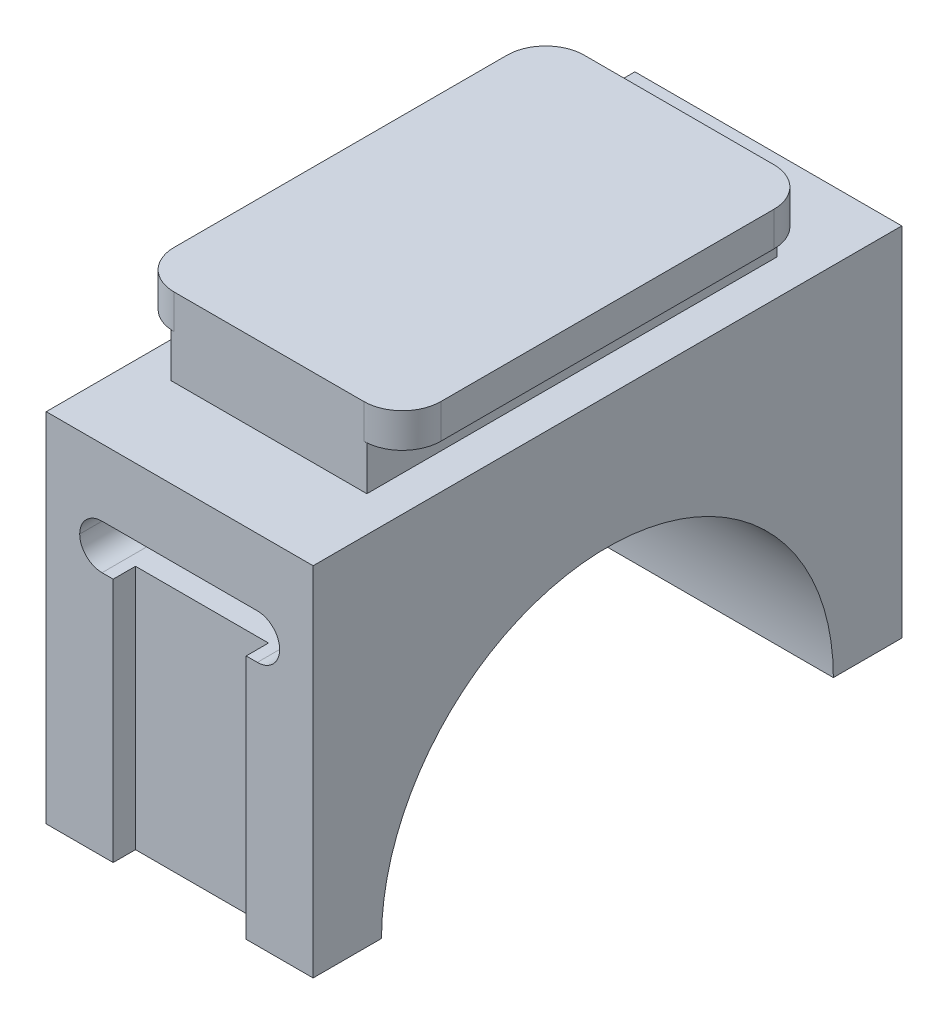
from build123d import *

# Parameters (mm, degrees)
BOSS_EXTRUDE1_DEPTH = 1.9558
SKETCH2_W           = 11.1506
SKETCH2_H           = 23.3426
BOSS_EXTRUDE2_DEPTH = 2.5019
SKETCH3_W           = 15.1892
SKETCH3_H           = 33.5026
BOSS_EXTRUDE3_DEPTH = 20.32
SKETCH4_R           = 12.85875
CUT_EXTRUDE1_DEPTH  = 40.489177087
SKETCH5_W           = 11.3792
SKETCH5_H           = 2.54
CUT_EXTRUDE2_DEPTH  = 44.289434312
FILLET1_R           = 1.27
SKETCH6_W           = 7.5692
SKETCH6_H           = 13.97
CUT_EXTRUDE3_DEPTH  = 1.27
SKETCH7_W           = 7.5692
SKETCH7_H           = 13.97
CUT_EXTRUDE4_DEPTH  = 1.27


with BuildPart() as part:
    # Sketch1 → Boss-Extrude1 (new body)
    with BuildSketch(Plane(origin=(0, 0, 0), x_dir=(1, 0, 0), z_dir=(0, 1, 0))):
        with BuildLine():
            Line((2.1971, 0), (12.9921, 0))
            ThreePointArc((12.9921, 0), (14.545684309, -0.643515691), (15.1892, -2.1971))
            Line((15.1892, -2.1971), (15.1892, -21.1455))
            ThreePointArc((15.1892, -21.1455), (14.545684309, -22.699084309), (12.9921, -23.3426))
            Line((12.9921, -23.3426), (2.1971, -23.3426))
            ThreePointArc((2.1971, -23.3426), (0.643515691, -22.699084309), (0, -21.1455))
            Line((0, -21.1455), (0, -2.1971))
            ThreePointArc((0, -2.1971), (0.643515691, -0.643515691), (2.1971, 0))
        make_face()
    extrude(amount=BOSS_EXTRUDE1_DEPTH)

    # Sketch2 → Boss-Extrude2 (add)
    with BuildSketch(Plane.XZ):
        with Locations((7.5946, 11.6713)):
            Rectangle(SKETCH2_W, SKETCH2_H)
    extrude(amount=BOSS_EXTRUDE2_DEPTH)

    # Sketch3 → Boss-Extrude3 (add)
    with BuildSketch(Plane.XZ.offset(2.5019)):
        with Locations((7.5946, 11.6713)):
            Rectangle(SKETCH3_W, SKETCH3_H)
    extrude(amount=BOSS_EXTRUDE3_DEPTH)

    # Sketch4 → Cut-Extrude1 (cut, through all)
    with BuildSketch(Plane(origin=(15.1892, 0, 0), x_dir=(0, 0, -1), z_dir=(1, 0, 0))):
        with Locations((-11.6713, -22.8219)):
            Circle(SKETCH4_R)
    extrude(amount=-CUT_EXTRUDE1_DEPTH, mode=Mode.SUBTRACT)

    # Sketch5 → Cut-Extrude2 (cut, through all)
    with BuildSketch(Plane.XY.offset(28.4226)):
        with Locations((7.5946, -7.5819)):
            Rectangle(SKETCH5_W, SKETCH5_H)
    extrude(amount=-CUT_EXTRUDE2_DEPTH, mode=Mode.SUBTRACT)

    # Fillet1
    fillet1_edges = [part.edges().sort_by_distance(p)[0] for p in [
        (13.2842, -8.8519, 11.6713),
        (13.2842, -6.3119, 11.6713),
        (1.905, -6.3119, 11.6713),
        (1.905, -8.8519, 11.6713),
    ]]
    fillet(fillet1_edges, radius=FILLET1_R - 0.0001)  # a hair under: the kernel refuses the full size

    # Sketch6 → Cut-Extrude3 (cut)
    with BuildSketch(Plane(origin=(0, 0, -5.08), x_dir=(-1, 0, 0), z_dir=(0, 0, -1))):
        with Locations((-7.5946, -15.8369)):
            Rectangle(SKETCH6_W, SKETCH6_H)
    extrude(amount=-CUT_EXTRUDE3_DEPTH, mode=Mode.SUBTRACT)

    # Sketch7 → Cut-Extrude4 (cut)
    with BuildSketch(Plane.XY.offset(28.4226)):
        with Locations((7.5946, -15.8369)):
            Rectangle(SKETCH7_W, SKETCH7_H)
    extrude(amount=-CUT_EXTRUDE4_DEPTH, mode=Mode.SUBTRACT)


solid = part.part
